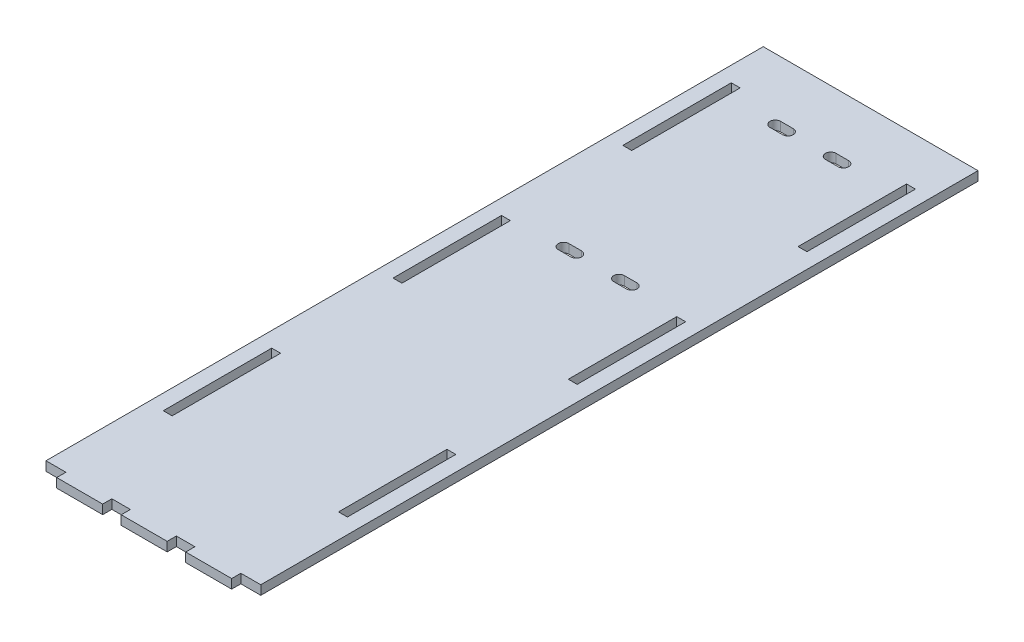
from build123d import *

# Parameters (mm, degrees)
SKETCH1_W           = 60.2
SKETCH1_H           = 160
BOSS_EXTRUDE1_DEPTH = 6
BOSS_EXTRUDE2_START = -6
SKETCH2_W           = 140.2
SKETCH2_H           = 468.2
BOSS_EXTRUDE2_DEPTH = 6
SKETCH3_W           = 5.8
SKETCH3_H           = 70.8
CUT_EXTRUDE1_DEPTH  = 6
SKETCH4_W           = 30
SKETCH4_H           = 6
BOSS_EXTRUDE3_DEPTH = 6


with BuildPart() as part:
    # Sketch1 → Boss-Extrude1 (new body)
    with BuildSketch(Plane(origin=(0, 0, 0), x_dir=(1, 0, 0), z_dir=(0, 1, 0))):
        with Locations((30.1, 80)):
            Rectangle(SKETCH1_W, SKETCH1_H)
        with BuildLine():
            Line((7.85, 152.55), (16.15, 152.55))
            ThreePointArc((16.15, 152.55), (19.6, 149.1), (16.15, 145.65))
            Line((16.15, 145.65), (7.85, 145.65))
            ThreePointArc((7.85, 145.65), (4.4, 149.1), (7.85, 152.55))
        make_face(mode=Mode.SUBTRACT)
        with BuildLine():
            Line((44.05, 145.65), (52.35, 145.65))
            ThreePointArc((52.35, 145.65), (55.8, 149.1), (52.35, 152.55))
            Line((52.35, 152.55), (44.05, 152.55))
            ThreePointArc((44.05, 152.55), (40.6, 149.1), (44.05, 145.65))
        make_face(mode=Mode.SUBTRACT)
        with BuildLine():
            Line((52.35, 7.45), (44.05, 7.45))
            ThreePointArc((44.05, 7.45), (40.6, 10.9), (44.05, 14.35))
            Line((44.05, 14.35), (52.35, 14.35))
            ThreePointArc((52.35, 14.35), (55.8, 10.9), (52.35, 7.45))
        make_face(mode=Mode.SUBTRACT)
        with BuildLine():
            Line((16.15, 14.35), (7.85, 14.35))
            ThreePointArc((7.85, 14.35), (4.4, 10.9), (7.85, 7.45))
            Line((7.85, 7.45), (16.15, 7.45))
            ThreePointArc((16.15, 7.45), (19.6, 10.9), (16.15, 14.35))
        make_face(mode=Mode.SUBTRACT)
    extrude(amount=BOSS_EXTRUDE1_DEPTH)

    # Sketch2 → Boss-Extrude2 (add)
    with BuildSketch(Plane(origin=(0, 6, 0), x_dir=(1, 0, 0), z_dir=(0, 1, 0)).offset(BOSS_EXTRUDE2_START)):
        with Locations((30.1, -45)):
            Rectangle(SKETCH2_W, SKETCH2_H)
        with BuildLine():
            Line((16.15, 7.45), (7.85, 7.45))
            ThreePointArc((7.85, 7.45), (4.4, 10.9), (7.85, 14.35))
            Line((7.85, 14.35), (16.15, 14.35))
            ThreePointArc((16.15, 14.35), (19.6, 10.9), (16.15, 7.45))
        make_face(mode=Mode.SUBTRACT)
        with BuildLine():
            Line((16.15, 145.65), (7.85, 145.65))
            ThreePointArc((7.85, 145.65), (4.4, 149.1), (7.85, 152.55))
            Line((7.85, 152.55), (16.15, 152.55))
            ThreePointArc((16.15, 152.55), (19.6, 149.1), (16.15, 145.65))
        make_face(mode=Mode.SUBTRACT)
        with BuildLine():
            Line((52.35, 7.45), (44.05, 7.45))
            ThreePointArc((44.05, 7.45), (40.6, 10.9), (44.05, 14.35))
            Line((44.05, 14.35), (52.35, 14.35))
            ThreePointArc((52.35, 14.35), (55.8, 10.9), (52.35, 7.45))
        make_face(mode=Mode.SUBTRACT)
        with BuildLine():
            Line((52.35, 145.65), (44.05, 145.65))
            ThreePointArc((44.05, 145.65), (40.6, 149.1), (44.05, 152.55))
            Line((44.05, 152.55), (52.35, 152.55))
            ThreePointArc((52.35, 152.55), (55.8, 149.1), (52.35, 145.65))
        make_face(mode=Mode.SUBTRACT)
    extrude(amount=BOSS_EXTRUDE2_DEPTH)

    # Sketch3 → Cut-Extrude1 (cut)
    with BuildSketch(Plane(origin=(0, 6, 0), x_dir=(1, 0, 0), z_dir=(0, 1, 0))):
        with Locations((87.3, 122.8465093)):
            Rectangle(SKETCH3_W, SKETCH3_H)
        with Locations((-27.1, 122.8465093)):
            Rectangle(SKETCH3_W, SKETCH3_H)
        with Locations((-27.1, -27.1534907)):
            Rectangle(SKETCH3_W, SKETCH3_H)
        with Locations((87.3, -27.1534907)):
            Rectangle(SKETCH3_W, SKETCH3_H)
        with Locations((-27.1, -177.1534907)):
            Rectangle(SKETCH3_W, SKETCH3_H)
        with Locations((87.3, -177.1534907)):
            Rectangle(SKETCH3_W, SKETCH3_H)
    extrude(amount=-CUT_EXTRUDE1_DEPTH, mode=Mode.SUBTRACT)

    # Sketch4 → Boss-Extrude3 (add)
    with BuildSketch(Plane(origin=(0, 6, 0), x_dir=(1, 0, 0), z_dir=(0, 1, 0))):
        with Locations((-12, -282.1)):
            Rectangle(SKETCH4_W, SKETCH4_H)
        with Locations((30.1, -282.1)):
            Rectangle(SKETCH4_W, SKETCH4_H)
        with Locations((72.2, -282.1)):
            Rectangle(SKETCH4_W, SKETCH4_H)
    extrude(amount=-BOSS_EXTRUDE3_DEPTH)


solid = part.part
